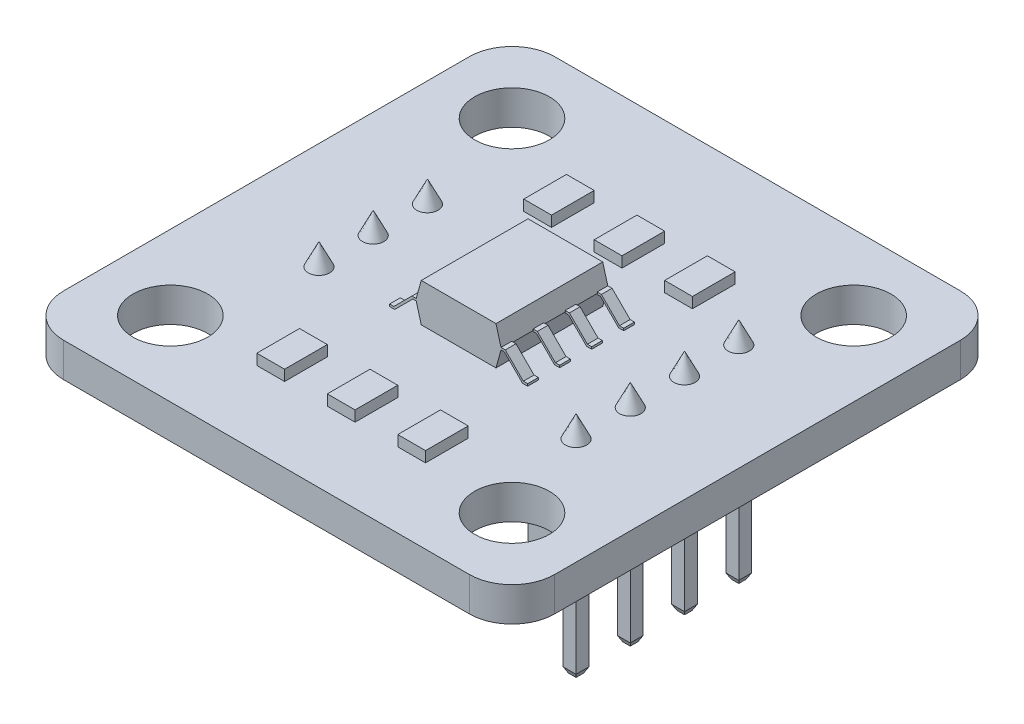
from build123d import *
from OCP.BRepFilletAPI import BRepFilletAPI_MakeChamfer

# Parameters (mm, degrees)
SKETCH_1_W             = 23
SKETCH_1_H             = 23
EXTRUDE_1_DEPTH        = 1.6
SKETCH_2_R             = 1.75
CUT_EXTRUDE_1_DEPTH    = 17.341970505
FILLET_1_R             = 2
SKETCH_4_W             = 4
SKETCH_4_H             = 5
EXTRUDE_2_DEPTH        = 1.8
CUT_EXTRUDE_2_DEPTH    = 19.433936096
EXTRUDE_3_DEPTH        = 0.5
PATTERN_LINEAR_1_COUNT = 4
PATTERN_LINEAR_1_PITCH = 1.5
SKETCH_8_W             = 1.3
SKETCH_8_H             = 2
EXTRUDE_4_DEPTH        = 0.5
SKETCH_9_R             = 0.5
EXTRUDE_5_DEPTH        = 1
CHAMFER_1_SIZE         = 1
CHAMFER_1_SIZE_2       = 0.487732589
EXTRUDE_6_DEPTH        = 2.4
PATTERN_LINEAR_2_COUNT = 3
PATTERN_LINEAR_2_PITCH = 2.54
EXTRUDE_7_DEPTH        = 2.4
SKETCH_12_W            = 0.6
SKETCH_12_H            = 0.6
EXTRUDE_8_DEPTH        = 5.5
CHAMFER_2_SIZE         = 0.25
CHAMFER_2_SIZE2        = 0.121933147


with BuildPart() as part:
    # 스케치1 → 보스-돌출1 (new body)
    with BuildSketch(Plane(origin=(0, 0, 0), x_dir=(1, 0, 0), z_dir=(0, 1, 0))):
        Rectangle(SKETCH_1_W, SKETCH_1_H)
    extrude(amount=EXTRUDE_1_DEPTH)

    # 스케치2 → 컷-돌출1 (cut, through all)
    with BuildSketch(Plane(origin=(0, 1.6, 0), x_dir=(1, 0, 0), z_dir=(0, 1, 0))):
        with Locations(Location((-8, 8, 0), (0, 0, 270))):
            Circle(SKETCH_2_R)
        with Locations(Location((8, 8, 0), (0, 0, 270))):
            Circle(SKETCH_2_R)
        with Locations(Location((8, -8, 0), (0, 0, 270))):
            Circle(SKETCH_2_R)
        with Locations(Location((-8, -8, 0), (0, 0, 270))):
            Circle(SKETCH_2_R)
    extrude(amount=-CUT_EXTRUDE_1_DEPTH, mode=Mode.SUBTRACT)

    # 필렛1
    fillet_1_edges = [part.edges().sort_by_distance(p)[0] for p in [
        (-11.5, 0.8, -11.5),
        (11.5, 0.8, -11.5),
        (11.5, 0.8, 11.5),
        (-11.5, 0.8, 11.5),
    ]]
    fillet(fillet_1_edges, radius=FILLET_1_R)

    # 스케치4 → 보스-돌출2 (add)
    with BuildSketch(Plane(origin=(0, 1.6, 0), x_dir=(1, 0, 0), z_dir=(0, 1, 0))):
        Rectangle(SKETCH_4_W, SKETCH_4_H)
    extrude(amount=EXTRUDE_2_DEPTH)

    # 스케치5 → 컷-돌출2 (cut, through all)
    with BuildSketch(Plane.XY.offset(2.5)):
        Polygon((-2, 3.4), (-2, 2.5), (-1.75, 3.4), align=None)
        Polygon((-2, 1.6), (-1.75, 1.6), (-2, 2.5), align=None)
        Polygon((2, 2.5), (1.75, 1.6), (2, 1.6), align=None)
        Polygon((1.75, 3.4), (2, 2.5), (2, 3.4), align=None)
    extrude(amount=-CUT_EXTRUDE_2_DEPTH, mode=Mode.SUBTRACT)

    # 스케치6 → 보스-돌출3 (add)
    with BuildSketch(Plane.XY.offset(2.5)):
        Polygon((-1.986111111, 2.55), (-1.986111111, 2.45), (-2.144689755, 2.45), (-2.994689755, 1.6), (-3.231990238, 1.6), (-3.231990238, 1.704120873), (-3.031990238, 1.704120873), (-2.186111111, 2.55), align=None)
        Polygon((3.031990238, 1.704120873), (2.186111111, 2.55), (1.986111111, 2.55), (1.986111111, 2.45), (2.144689755, 2.45), (2.994689755, 1.6), (3.231990238, 1.6), (3.231990238, 1.704120873), align=None)
    extrude_3 = extrude(amount=-EXTRUDE_3_DEPTH)

    # 선형 패턴1: 보스-돌출3 ×4
    with Locations(*[(0, 0, -i * PATTERN_LINEAR_1_PITCH) for i in range(1, PATTERN_LINEAR_1_COUNT)]):
        add(extrude_3)

    # 스케치8 → 보스-돌출4 (add)
    with BuildSketch(Plane(origin=(0, 1.6, 0), x_dir=(1, 0, 0), z_dir=(0, 1, 0))):
        with Locations((-3.3, 5.5)):
            Rectangle(SKETCH_8_W, SKETCH_8_H)
        with Locations((0, 5.5)):
            Rectangle(SKETCH_8_W, SKETCH_8_H)
        with Locations((3.3, 5.5)):
            Rectangle(SKETCH_8_W, SKETCH_8_H)
        with Locations((-3.3, -7)):
            Rectangle(SKETCH_8_W, SKETCH_8_H)
        with Locations((0, -7)):
            Rectangle(SKETCH_8_W, SKETCH_8_H)
        with Locations((3.3, -7)):
            Rectangle(SKETCH_8_W, SKETCH_8_H)
    extrude(amount=EXTRUDE_4_DEPTH)

    # 스케치9 → 보스-돌출5 (add)
    with BuildSketch(Plane(origin=(0, 1.6, 0), x_dir=(1, 0, 0), z_dir=(0, 1, 0))):
        with Locations(Location((-6.5, 2.54, 0), (0, 0, 270))):
            Circle(SKETCH_9_R)
        with Locations(Location((-6.5, 0, 0), (0, 0, 270))):
            Circle(SKETCH_9_R)
        with Locations(Location((-6.5, -2.54, 0), (0, 0, 270))):
            Circle(SKETCH_9_R)
        with Locations(Location((6.5, -0.96, 0), (0, 0, 270))):
            Circle(SKETCH_9_R)
        with Locations(Location((6.5, 1.58, 0), (0, 0, 270))):
            Circle(SKETCH_9_R)
        with Locations(Location((6.5, 4.12, 0), (0, 0, 270))):
            Circle(SKETCH_9_R)
        with Locations(Location((6.5, -3.5, 0), (0, 0, 270))):
            Circle(SKETCH_9_R)
    extrude(amount=EXTRUDE_5_DEPTH)

    # 모따기1
    chamfer_1_edges_1 = [part.edges().sort_by_distance(p)[0] for p in [
        (-6.5, 2.6, -3.04),
    ]]
    chamfer_1_side_1 = [part.faces().sort_by_distance(p)[0] for p in [
        (-6.5, 2.590245348, -3.04),
    ]]
    chamfer_1_edges_2 = [part.edges().sort_by_distance(p)[0] for p in [
        (-6.5, 2.6, -0.5),
    ]]
    chamfer_1_side_2 = [part.faces().sort_by_distance(p)[0] for p in [
        (-6.5, 2.590245348, -0.5),
    ]]
    chamfer_1_edges_3 = [part.edges().sort_by_distance(p)[0] for p in [
        (-6.5, 2.6, 2.04),
    ]]
    chamfer_1_side_3 = [part.faces().sort_by_distance(p)[0] for p in [
        (-6.5, 2.590245348, 2.04),
    ]]
    chamfer_1_edges_4 = [part.edges().sort_by_distance(p)[0] for p in [
        (6.5, 2.6, 0.46),
    ]]
    chamfer_1_side_4 = [part.faces().sort_by_distance(p)[0] for p in [
        (6.5, 2.590245348, 0.46),
    ]]
    chamfer_1_edges_5 = [part.edges().sort_by_distance(p)[0] for p in [
        (6.5, 2.6, -2.08),
    ]]
    chamfer_1_side_5 = [part.faces().sort_by_distance(p)[0] for p in [
        (6.5, 2.590245348, -2.08),
    ]]
    chamfer_1_edges_6 = [part.edges().sort_by_distance(p)[0] for p in [
        (6.5, 2.6, -4.62),
    ]]
    chamfer_1_side_6 = [part.faces().sort_by_distance(p)[0] for p in [
        (6.5, 2.590245348, -4.62),
    ]]
    chamfer_1_edges_7 = [part.edges().sort_by_distance(p)[0] for p in [
        (6.5, 2.6, 3),
    ]]
    chamfer_1_side_7 = [part.faces().sort_by_distance(p)[0] for p in [
        (6.5, 2.590245348, 3),
    ]]
    chamfer_1 = BRepFilletAPI_MakeChamfer(part.part.solid().wrapped)
    for e in chamfer_1_edges_1:
        chamfer_1.Add(CHAMFER_1_SIZE - 0.0001, CHAMFER_1_SIZE_2 - 0.0001, e.wrapped, chamfer_1_side_1[0].wrapped)
    for e in chamfer_1_edges_2:
        chamfer_1.Add(CHAMFER_1_SIZE - 0.0001, CHAMFER_1_SIZE_2 - 0.0001, e.wrapped, chamfer_1_side_2[0].wrapped)
    for e in chamfer_1_edges_3:
        chamfer_1.Add(CHAMFER_1_SIZE - 0.0001, CHAMFER_1_SIZE_2 - 0.0001, e.wrapped, chamfer_1_side_3[0].wrapped)
    for e in chamfer_1_edges_4:
        chamfer_1.Add(CHAMFER_1_SIZE - 0.0001, CHAMFER_1_SIZE_2 - 0.0001, e.wrapped, chamfer_1_side_4[0].wrapped)
    for e in chamfer_1_edges_5:
        chamfer_1.Add(CHAMFER_1_SIZE - 0.0001, CHAMFER_1_SIZE_2 - 0.0001, e.wrapped, chamfer_1_side_5[0].wrapped)
    for e in chamfer_1_edges_6:
        chamfer_1.Add(CHAMFER_1_SIZE - 0.0001, CHAMFER_1_SIZE_2 - 0.0001, e.wrapped, chamfer_1_side_6[0].wrapped)
    for e in chamfer_1_edges_7:
        chamfer_1.Add(CHAMFER_1_SIZE - 0.0001, CHAMFER_1_SIZE_2 - 0.0001, e.wrapped, chamfer_1_side_7[0].wrapped)
    add(Compound.cast(chamfer_1.Shape()), mode=Mode.REPLACE)  # a hair under: the kernel refuses the full size

    # 스케치10 → 보스-돌출6 (add)
    with BuildSketch(Plane.XZ):
        Polygon((-7.77, 3.51), (-7.77, 1.57), (-7.47, 1.27), (-5.53, 1.27), (-5.23, 1.57), (-5.23, 3.51), (-5.53, 3.81), (-7.47, 3.81), align=None)
        Polygon((5.23, 4.47), (5.23, 2.53), (5.53, 2.23), (7.47, 2.23), (7.77, 2.53), (7.77, 4.47), (7.47, 4.77), (5.53, 4.77), align=None)
    extrude_6 = extrude(amount=EXTRUDE_6_DEPTH)

    # 선형 패턴2: 보스-돌출6 ×3
    with Locations(*[(0, 0, -i * PATTERN_LINEAR_2_PITCH) for i in range(1, PATTERN_LINEAR_2_COUNT)]):
        add(extrude_6)

    # 스케치11 → 보스-돌출7 (add)
    with BuildSketch(Plane.XZ):
        Polygon((5.53, -2.85), (7.47, -2.85), (7.77, -3.15), (7.77, -5.09), (7.47, -5.39), (5.53, -5.39), (5.23, -5.09), (5.23, -3.15), align=None)
    extrude(amount=EXTRUDE_7_DEPTH)

    # 스케치12 → 보스-돌출8 (add)
    with BuildSketch(Plane.XZ.offset(2.4)):
        with Locations((-6.5, 2.54)):
            Rectangle(SKETCH_12_W, SKETCH_12_H)
        with Locations((-6.5, 0)):
            Rectangle(SKETCH_12_W, SKETCH_12_H)
        with Locations((-6.5, -2.54)):
            Rectangle(SKETCH_12_W, SKETCH_12_H)
        with Locations((6.5, 0.96)):
            Rectangle(SKETCH_12_W, SKETCH_12_H)
        with Locations((6.5, 3.5)):
            Rectangle(SKETCH_12_W, SKETCH_12_H)
        with Locations((6.5, -1.58)):
            Rectangle(SKETCH_12_W, SKETCH_12_H)
        with Locations((6.5, -4.12)):
            Rectangle(SKETCH_12_W, SKETCH_12_H)
    extrude(amount=EXTRUDE_8_DEPTH)

    # 모따기2: one chamfer whose edges measure the first distance from different faces: ONE call of the kernel's chamfer builder (chamfer() names one face for all edges)
    chamfer_2_edges_1 = [part.edges().sort_by_distance(p)[0] for p in [
        (-6.2, -7.9, 2.54),
    ]]
    chamfer_2_side_1 = [part.faces().sort_by_distance(p)[0] for p in [
        (-6.2, -5.15, 2.54),
    ]]
    chamfer_2_edges_2 = [part.edges().sort_by_distance(p)[0] for p in [
        (-6.5, -7.9, 2.84),
    ]]
    chamfer_2_side_2 = [part.faces().sort_by_distance(p)[0] for p in [
        (-6.5, -5.15, 2.84),
    ]]
    chamfer_2_edges_3 = [part.edges().sort_by_distance(p)[0] for p in [
        (-6.8, -7.9, 2.54),
    ]]
    chamfer_2_side_3 = [part.faces().sort_by_distance(p)[0] for p in [
        (-6.8, -5.15, 2.54),
    ]]
    chamfer_2_edges_4 = [part.edges().sort_by_distance(p)[0] for p in [
        (-6.5, -7.9, 2.24),
    ]]
    chamfer_2_side_4 = [part.faces().sort_by_distance(p)[0] for p in [
        (-6.5, -5.15, 2.24),
    ]]
    chamfer_2_edges_5 = [part.edges().sort_by_distance(p)[0] for p in [
        (-6.5, -7.9, 0.3),
    ]]
    chamfer_2_side_5 = [part.faces().sort_by_distance(p)[0] for p in [
        (-6.5, -5.15, 0.3),
    ]]
    chamfer_2_edges_6 = [part.edges().sort_by_distance(p)[0] for p in [
        (-6.8, -7.9, 0),
    ]]
    chamfer_2_side_6 = [part.faces().sort_by_distance(p)[0] for p in [
        (-6.8, -5.15, 0),
    ]]
    chamfer_2_edges_7 = [part.edges().sort_by_distance(p)[0] for p in [
        (-6.5, -7.9, -0.3),
    ]]
    chamfer_2_side_7 = [part.faces().sort_by_distance(p)[0] for p in [
        (-6.5, -5.15, -0.3),
    ]]
    chamfer_2_edges_8 = [part.edges().sort_by_distance(p)[0] for p in [
        (-6.2, -7.9, 0),
    ]]
    chamfer_2_side_8 = [part.faces().sort_by_distance(p)[0] for p in [
        (-6.2, -5.15, 0),
    ]]
    chamfer_2_edges_9 = [part.edges().sort_by_distance(p)[0] for p in [
        (-6.5, -7.9, -2.24),
    ]]
    chamfer_2_side_9 = [part.faces().sort_by_distance(p)[0] for p in [
        (-6.5, -5.15, -2.24),
    ]]
    chamfer_2_edges_10 = [part.edges().sort_by_distance(p)[0] for p in [
        (-6.8, -7.9, -2.54),
    ]]
    chamfer_2_side_10 = [part.faces().sort_by_distance(p)[0] for p in [
        (-6.8, -5.15, -2.54),
    ]]
    chamfer_2_edges_11 = [part.edges().sort_by_distance(p)[0] for p in [
        (-6.5, -7.9, -2.84),
    ]]
    chamfer_2_side_11 = [part.faces().sort_by_distance(p)[0] for p in [
        (-6.5, -5.15, -2.84),
    ]]
    chamfer_2_edges_12 = [part.edges().sort_by_distance(p)[0] for p in [
        (-6.2, -7.9, -2.54),
    ]]
    chamfer_2_side_12 = [part.faces().sort_by_distance(p)[0] for p in [
        (-6.2, -5.15, -2.54),
    ]]
    chamfer_2_edges_13 = [part.edges().sort_by_distance(p)[0] for p in [
        (6.8, -7.9, 3.5),
    ]]
    chamfer_2_side_13 = [part.faces().sort_by_distance(p)[0] for p in [
        (6.8, -5.15, 3.5),
    ]]
    chamfer_2_edges_14 = [part.edges().sort_by_distance(p)[0] for p in [
        (6.5, -7.9, 3.8),
    ]]
    chamfer_2_side_14 = [part.faces().sort_by_distance(p)[0] for p in [
        (6.5, -5.15, 3.8),
    ]]
    chamfer_2_edges_15 = [part.edges().sort_by_distance(p)[0] for p in [
        (6.2, -7.9, 3.5),
    ]]
    chamfer_2_side_15 = [part.faces().sort_by_distance(p)[0] for p in [
        (6.2, -5.15, 3.5),
    ]]
    chamfer_2_edges_16 = [part.edges().sort_by_distance(p)[0] for p in [
        (6.5, -7.9, 3.2),
    ]]
    chamfer_2_side_16 = [part.faces().sort_by_distance(p)[0] for p in [
        (6.5, -5.15, 3.2),
    ]]
    chamfer_2_edges_17 = [part.edges().sort_by_distance(p)[0] for p in [
        (6.5, -7.9, 1.26),
    ]]
    chamfer_2_side_17 = [part.faces().sort_by_distance(p)[0] for p in [
        (6.5, -5.15, 1.26),
    ]]
    chamfer_2_edges_18 = [part.edges().sort_by_distance(p)[0] for p in [
        (6.2, -7.9, 0.96),
    ]]
    chamfer_2_side_18 = [part.faces().sort_by_distance(p)[0] for p in [
        (6.2, -5.15, 0.96),
    ]]
    chamfer_2_edges_19 = [part.edges().sort_by_distance(p)[0] for p in [
        (6.5, -7.9, 0.66),
    ]]
    chamfer_2_side_19 = [part.faces().sort_by_distance(p)[0] for p in [
        (6.5, -5.15, 0.66),
    ]]
    chamfer_2_edges_20 = [part.edges().sort_by_distance(p)[0] for p in [
        (6.8, -7.9, 0.96),
    ]]
    chamfer_2_side_20 = [part.faces().sort_by_distance(p)[0] for p in [
        (6.8, -5.15, 0.96),
    ]]
    chamfer_2_edges_21 = [part.edges().sort_by_distance(p)[0] for p in [
        (6.5, -7.9, -1.28),
    ]]
    chamfer_2_side_21 = [part.faces().sort_by_distance(p)[0] for p in [
        (6.5, -5.15, -1.28),
    ]]
    chamfer_2_edges_22 = [part.edges().sort_by_distance(p)[0] for p in [
        (6.2, -7.9, -1.58),
    ]]
    chamfer_2_side_22 = [part.faces().sort_by_distance(p)[0] for p in [
        (6.2, -5.15, -1.58),
    ]]
    chamfer_2_edges_23 = [part.edges().sort_by_distance(p)[0] for p in [
        (6.5, -7.9, -1.88),
    ]]
    chamfer_2_side_23 = [part.faces().sort_by_distance(p)[0] for p in [
        (6.5, -5.15, -1.88),
    ]]
    chamfer_2_edges_24 = [part.edges().sort_by_distance(p)[0] for p in [
        (6.8, -7.9, -1.58),
    ]]
    chamfer_2_side_24 = [part.faces().sort_by_distance(p)[0] for p in [
        (6.8, -5.15, -1.58),
    ]]
    chamfer_2_edges_25 = [part.edges().sort_by_distance(p)[0] for p in [
        (6.5, -7.9, -3.82),
    ]]
    chamfer_2_side_25 = [part.faces().sort_by_distance(p)[0] for p in [
        (6.5, -5.15, -3.82),
    ]]
    chamfer_2_edges_26 = [part.edges().sort_by_distance(p)[0] for p in [
        (6.2, -7.9, -4.12),
    ]]
    chamfer_2_side_26 = [part.faces().sort_by_distance(p)[0] for p in [
        (6.2, -5.15, -4.12),
    ]]
    chamfer_2_edges_27 = [part.edges().sort_by_distance(p)[0] for p in [
        (6.5, -7.9, -4.42),
    ]]
    chamfer_2_side_27 = [part.faces().sort_by_distance(p)[0] for p in [
        (6.5, -5.15, -4.42),
    ]]
    chamfer_2_edges_28 = [part.edges().sort_by_distance(p)[0] for p in [
        (6.8, -7.9, -4.12),
    ]]
    chamfer_2_side_28 = [part.faces().sort_by_distance(p)[0] for p in [
        (6.8, -5.15, -4.12),
    ]]
    chamfer_2 = BRepFilletAPI_MakeChamfer(part.part.solid().wrapped)
    for e in chamfer_2_edges_1:
        chamfer_2.Add(CHAMFER_2_SIZE, CHAMFER_2_SIZE2, e.wrapped, chamfer_2_side_1[0].wrapped)  # the first distance lies on this face
    for e in chamfer_2_edges_2:
        chamfer_2.Add(CHAMFER_2_SIZE, CHAMFER_2_SIZE2, e.wrapped, chamfer_2_side_2[0].wrapped)  # the first distance lies on this face
    for e in chamfer_2_edges_3:
        chamfer_2.Add(CHAMFER_2_SIZE, CHAMFER_2_SIZE2, e.wrapped, chamfer_2_side_3[0].wrapped)  # the first distance lies on this face
    for e in chamfer_2_edges_4:
        chamfer_2.Add(CHAMFER_2_SIZE, CHAMFER_2_SIZE2, e.wrapped, chamfer_2_side_4[0].wrapped)  # the first distance lies on this face
    for e in chamfer_2_edges_5:
        chamfer_2.Add(CHAMFER_2_SIZE, CHAMFER_2_SIZE2, e.wrapped, chamfer_2_side_5[0].wrapped)  # the first distance lies on this face
    for e in chamfer_2_edges_6:
        chamfer_2.Add(CHAMFER_2_SIZE, CHAMFER_2_SIZE2, e.wrapped, chamfer_2_side_6[0].wrapped)  # the first distance lies on this face
    for e in chamfer_2_edges_7:
        chamfer_2.Add(CHAMFER_2_SIZE, CHAMFER_2_SIZE2, e.wrapped, chamfer_2_side_7[0].wrapped)  # the first distance lies on this face
    for e in chamfer_2_edges_8:
        chamfer_2.Add(CHAMFER_2_SIZE, CHAMFER_2_SIZE2, e.wrapped, chamfer_2_side_8[0].wrapped)  # the first distance lies on this face
    for e in chamfer_2_edges_9:
        chamfer_2.Add(CHAMFER_2_SIZE, CHAMFER_2_SIZE2, e.wrapped, chamfer_2_side_9[0].wrapped)  # the first distance lies on this face
    for e in chamfer_2_edges_10:
        chamfer_2.Add(CHAMFER_2_SIZE, CHAMFER_2_SIZE2, e.wrapped, chamfer_2_side_10[0].wrapped)  # the first distance lies on this face
    for e in chamfer_2_edges_11:
        chamfer_2.Add(CHAMFER_2_SIZE, CHAMFER_2_SIZE2, e.wrapped, chamfer_2_side_11[0].wrapped)  # the first distance lies on this face
    for e in chamfer_2_edges_12:
        chamfer_2.Add(CHAMFER_2_SIZE, CHAMFER_2_SIZE2, e.wrapped, chamfer_2_side_12[0].wrapped)  # the first distance lies on this face
    for e in chamfer_2_edges_13:
        chamfer_2.Add(CHAMFER_2_SIZE, CHAMFER_2_SIZE2, e.wrapped, chamfer_2_side_13[0].wrapped)  # the first distance lies on this face
    for e in chamfer_2_edges_14:
        chamfer_2.Add(CHAMFER_2_SIZE, CHAMFER_2_SIZE2, e.wrapped, chamfer_2_side_14[0].wrapped)  # the first distance lies on this face
    for e in chamfer_2_edges_15:
        chamfer_2.Add(CHAMFER_2_SIZE, CHAMFER_2_SIZE2, e.wrapped, chamfer_2_side_15[0].wrapped)  # the first distance lies on this face
    for e in chamfer_2_edges_16:
        chamfer_2.Add(CHAMFER_2_SIZE, CHAMFER_2_SIZE2, e.wrapped, chamfer_2_side_16[0].wrapped)  # the first distance lies on this face
    for e in chamfer_2_edges_17:
        chamfer_2.Add(CHAMFER_2_SIZE, CHAMFER_2_SIZE2, e.wrapped, chamfer_2_side_17[0].wrapped)  # the first distance lies on this face
    for e in chamfer_2_edges_18:
        chamfer_2.Add(CHAMFER_2_SIZE, CHAMFER_2_SIZE2, e.wrapped, chamfer_2_side_18[0].wrapped)  # the first distance lies on this face
    for e in chamfer_2_edges_19:
        chamfer_2.Add(CHAMFER_2_SIZE, CHAMFER_2_SIZE2, e.wrapped, chamfer_2_side_19[0].wrapped)  # the first distance lies on this face
    for e in chamfer_2_edges_20:
        chamfer_2.Add(CHAMFER_2_SIZE, CHAMFER_2_SIZE2, e.wrapped, chamfer_2_side_20[0].wrapped)  # the first distance lies on this face
    for e in chamfer_2_edges_21:
        chamfer_2.Add(CHAMFER_2_SIZE, CHAMFER_2_SIZE2, e.wrapped, chamfer_2_side_21[0].wrapped)  # the first distance lies on this face
    for e in chamfer_2_edges_22:
        chamfer_2.Add(CHAMFER_2_SIZE, CHAMFER_2_SIZE2, e.wrapped, chamfer_2_side_22[0].wrapped)  # the first distance lies on this face
    for e in chamfer_2_edges_23:
        chamfer_2.Add(CHAMFER_2_SIZE, CHAMFER_2_SIZE2, e.wrapped, chamfer_2_side_23[0].wrapped)  # the first distance lies on this face
    for e in chamfer_2_edges_24:
        chamfer_2.Add(CHAMFER_2_SIZE, CHAMFER_2_SIZE2, e.wrapped, chamfer_2_side_24[0].wrapped)  # the first distance lies on this face
    for e in chamfer_2_edges_25:
        chamfer_2.Add(CHAMFER_2_SIZE, CHAMFER_2_SIZE2, e.wrapped, chamfer_2_side_25[0].wrapped)  # the first distance lies on this face
    for e in chamfer_2_edges_26:
        chamfer_2.Add(CHAMFER_2_SIZE, CHAMFER_2_SIZE2, e.wrapped, chamfer_2_side_26[0].wrapped)  # the first distance lies on this face
    for e in chamfer_2_edges_27:
        chamfer_2.Add(CHAMFER_2_SIZE, CHAMFER_2_SIZE2, e.wrapped, chamfer_2_side_27[0].wrapped)  # the first distance lies on this face
    for e in chamfer_2_edges_28:
        chamfer_2.Add(CHAMFER_2_SIZE, CHAMFER_2_SIZE2, e.wrapped, chamfer_2_side_28[0].wrapped)  # the first distance lies on this face
    add(Compound.cast(chamfer_2.Shape()), mode=Mode.REPLACE)


solid = part.part
